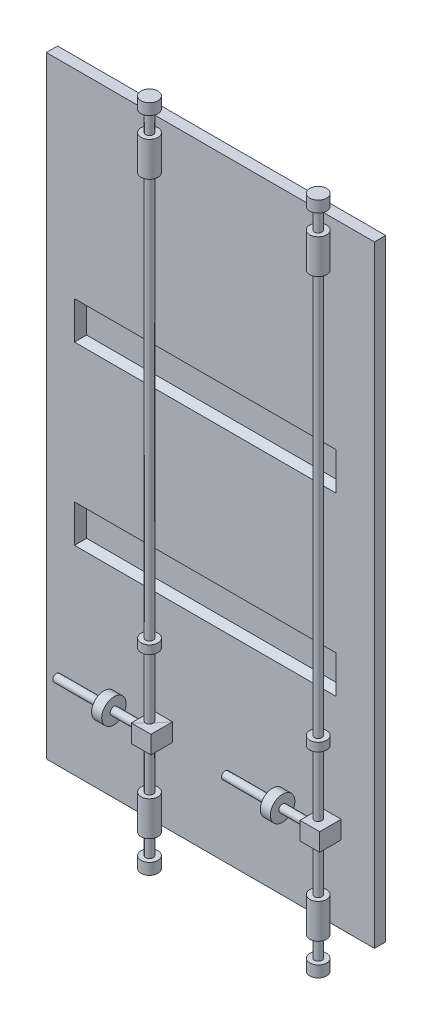
from build123d import *

# Parameters (mm, degrees)
SKETCH1_W                    = 1167
SKETCH1_H                    = 2176
BOSS_EXTRUDE1_DEPTH          = 40
SKETCH2_W                    = 931
SKETCH2_H                    = 134
CUT_EXTRUDE1_DEPTH           = 27
CUT_EXTRUDE1_DRAFT           = -31
CUT_EXTRUDE1_PROFILE_2_DEPTH = 27
CUT_EXTRUDE1_PROFILE_2_DRAFT = -31
CUT_EXTRUDE2_START           = -90
CUT_EXTRUDE2_DEPTH           = 917
BOSS_EXTRUDE2_START          = 110
SKETCH4_R                    = 13.5
BOSS_EXTRUDE2_DEPTH          = 2380
SKETCH5_R                    = 30
BOSS_EXTRUDE3_DEPTH          = 40
BOSS_EXTRUDE4_START          = -113
SKETCH6_R                    = 30
BOSS_EXTRUDE4_DEPTH          = 123
BOSS_EXTRUDE5_START          = -40
SKETCH8_W                    = 76.691760354
SKETCH8_H                    = 63.527166665
BOSS_EXTRUDE5_DEPTH          = 70
SKETCH9_R                    = 13.5
BOSS_EXTRUDE6_DEPTH          = 344
BOSS_EXTRUDE7_START          = -140
SKETCH10_R                   = 43.5
BOSS_EXTRUDE7_DEPTH          = 36
BOSS_EXTRUDE8_START          = -1670
SKETCH11_R                   = 30
BOSS_EXTRUDE8_DEPTH          = 30
LPATTERN2_COUNT              = 2
LPATTERN2_PITCH              = 600
LPATTERN3_START              = -805.424590627
LPATTERN3_OUTLINE_R          = 30
LPATTERN3_DEPTH              = 30
LPATTERN3_START_2            = 61.654119823
LPATTERN3_2_OUTLINE_W        = 70
LPATTERN3_2_OUTLINE_H        = 63.527166665
LPATTERN3_2_DEPTH            = 76.691760354
LPATTERN3_START_3            = 658.575409373
LPATTERN3_3_OUTLINE_R        = 30
LPATTERN3_3_DEPTH            = 123
LPATTERN3_START_4            = 854.575409373
LPATTERN3_4_OUTLINE_R        = 30
LPATTERN3_4_DEPTH            = 40
LPATTERN3_START_5            = 607.040200233
LPATTERN3_5_OUTLINE_W        = 63.527166665
LPATTERN3_5_OUTLINE_H        = 76.691760354
LPATTERN3_5_DEPTH            = 70
LPATTERN3_START_6            = 471.040200233
LPATTERN3_6_OUTLINE_R        = 43.5
LPATTERN3_6_DEPTH            = 36
LPATTERN3_START_7            = 303.040200233
LPATTERN3_7_OUTLINE_R        = 13.5
LPATTERN3_7_DEPTH            = 304
SKETCH12_R                   = 30
BOSS_EXTRUDE9_DEPTH          = 40
BOSS_EXTRUDE10_START         = -113
SKETCH13_R                   = 30
BOSS_EXTRUDE10_DEPTH         = 123


# Read off the part's stored shape, not the designer's step: LPattern3
with BuildPart() as part:
    # Sketch1 → Boss-Extrude1 (new body)
    with BuildSketch(Plane.XY):
        with Locations((790.040200233, -303.424590627)):
            Rectangle(SKETCH1_W, SKETCH1_H)
    extrude(amount=BOSS_EXTRUDE1_DEPTH)


with BuildPart() as cut_extrude1_tool:
    # Sketch2 → Cut-Extrude1 (with draft: the straight prism first)
    with BuildSketch(Plane.XY.offset(40)):
        with Locations((772.040200233, 9.575409373)):
            Rectangle(SKETCH2_W, SKETCH2_H)
    extrude(amount=-CUT_EXTRUDE1_DEPTH)
    # Cut-Extrude1: the draft: its side faces are tilted about the plane it starts from
    cut_extrude1_sides = [cut_extrude1_tool.faces().sort_by_distance(p)[0] for p in [
        (306.540200233, 9.575409373, 26.5),
        (772.040200233, -57.424590627, 26.5),
        (1237.540200233, 9.575409373, 26.5),
        (772.040200233, 76.575409373, 26.5),
    ]]
    draft(cut_extrude1_sides, Plane.XY.offset(40), CUT_EXTRUDE1_DRAFT)


with BuildPart() as part_1:
    add(part.part)

    # Cut-Extrude1: cut by cut_extrude1_tool
    add(cut_extrude1_tool.part, mode=Mode.SUBTRACT)


with BuildPart() as cut_extrude1_profile_2_tool:
    # Sketch2 → Cut-Extrude1 profile 2 (with draft: the straight prism first)
    with BuildSketch(Plane.XY.offset(40)):
        with Locations((772.040200233, -616.424590627)):
            Rectangle(SKETCH2_W, SKETCH2_H)
    extrude(amount=-CUT_EXTRUDE1_PROFILE_2_DEPTH)
    # Cut-Extrude1 profile 2: the draft: its side faces are tilted about the plane it starts from
    cut_extrude1_profile_2_sides = [cut_extrude1_profile_2_tool.faces().sort_by_distance(p)[0] for p in [
        (306.540200233, -616.424590627, 26.5),
        (772.040200233, -683.424590627, 26.5),
        (1237.540200233, -616.424590627, 26.5),
        (772.040200233, -549.424590627, 26.5),
    ]]
    draft(cut_extrude1_profile_2_sides, Plane.XY.offset(40), CUT_EXTRUDE1_PROFILE_2_DRAFT)


with BuildPart() as part_2:
    add(part_1.part)

    # Cut-Extrude1 profile 2: cut by cut_extrude1_profile_2_tool
    add(cut_extrude1_profile_2_tool.part, mode=Mode.SUBTRACT)

    # Sketch3 → Cut-Extrude2 (cut)
    with BuildSketch(Plane(origin=(1373.540200233, 0, 0), x_dir=(0, 0, -1), z_dir=(1, 0, 0)).offset(CUT_EXTRUDE2_START)):
        Polygon((-30, 634.575409373), (-30, 71.566803182), (-3, 55.343566469), (-3, -36.156433531), (-30, -52.379670245), (-30, -340.424590627), (0, -340.424590627), (0, 634.575409373), align=None)
    cut_extrude2 = extrude(amount=-CUT_EXTRUDE2_DEPTH, mode=Mode.SUBTRACT)

    # Mirror1: Cut-Extrude2 across plane
    add(cut_extrude2.mirror(Plane.ZX.offset(-303.424590627)), mode=Mode.SUBTRACT)


with BuildPart() as body_2:
    # Sketch4 → Boss-Extrude2 (new body)
    with BuildSketch(Plane(origin=(0, 784.575409373, 0), x_dir=(1, 0, 0), z_dir=(0, 1, 0)).offset(BOSS_EXTRUDE2_START)):
        with Locations(Location((1233.540200233, -100, 0), (0, 0, 270))):
            Circle(SKETCH4_R)
    boss_extrude2 = extrude(amount=-BOSS_EXTRUDE2_DEPTH)

    # Sketch5 → Boss-Extrude3 (add)
    with BuildSketch(Plane(origin=(0, 894.575409373, 0), x_dir=(1, 0, 0), z_dir=(0, 1, 0))):
        with Locations(Location((1233.540200233, -100, 0), (0, 0, 270))):
            Circle(SKETCH5_R)
    boss_extrude3 = extrude(amount=-BOSS_EXTRUDE3_DEPTH)

    # Sketch6 → Boss-Extrude4 (add)
    with BuildSketch(Plane(origin=(0, 894.575409373, 0), x_dir=(1, 0, 0), z_dir=(0, 1, 0)).offset(BOSS_EXTRUDE4_START)):
        with Locations(Location((1233.540200233, -100, 0), (0, 0, 270))):
            Circle(SKETCH6_R)
    boss_extrude4 = extrude(amount=-BOSS_EXTRUDE4_DEPTH)

    # Mirror2: Boss-Extrude3, Boss-Extrude4 across plane
    add(boss_extrude3.mirror(Plane.ZX.offset(-303.424590627)))
    add(boss_extrude4.mirror(Plane.ZX.offset(-303.424590627)))


with BuildPart() as body_3:
    # Sketch8 → Boss-Extrude5 (new body)
    with BuildSketch(Plane(origin=(1247.040200233, 0, 0), x_dir=(0, 0, -1), z_dir=(1, 0, 0)).offset(BOSS_EXTRUDE5_START)):
        with Locations((-100, -1062.824787132)):
            Rectangle(SKETCH8_W, SKETCH8_H)
    extrude(amount=BOSS_EXTRUDE5_DEPTH)

    # Sketch9 → Boss-Extrude6 (add)
    with BuildSketch(Plane(origin=(1247.040200233, 0, 0), x_dir=(0, 0, -1), z_dir=(1, 0, 0))):
        with Locations((-100, -1062.824787132)):
            Circle(SKETCH9_R)
    extrude(amount=-BOSS_EXTRUDE6_DEPTH)

    # Sketch10 → Boss-Extrude7 (add)
    with BuildSketch(Plane(origin=(1247.040200233, 0, 0), x_dir=(0, 0, -1), z_dir=(1, 0, 0)).offset(BOSS_EXTRUDE7_START)):
        with Locations((-100, -1062.824787132)):
            Circle(SKETCH10_R)
    extrude(amount=-BOSS_EXTRUDE7_DEPTH)


with BuildPart() as body_4:
    # Sketch11 → Boss-Extrude8 (new body)
    with BuildSketch(Plane(origin=(0, 894.575409373, 0), x_dir=(1, 0, 0), z_dir=(0, 1, 0)).offset(BOSS_EXTRUDE8_START)):
        with Locations(Location((1233.540200233, -100, 0), (0, 0, 270))):
            Circle(SKETCH11_R)
    extrude(amount=-BOSS_EXTRUDE8_DEPTH)


with BuildPart() as lpattern2_1:
    # LPattern2: Boss-Extrude2 ×2
    with Locations(*[(-i * LPATTERN2_PITCH, 0, 0) for i in range(1, LPATTERN2_COUNT)]):
        add(boss_extrude2)

    # LPattern3 3 outline → LPattern3 3 (add)
    with BuildSketch(Plane(origin=(0, 0, 0), x_dir=(1, 0, 0), z_dir=(0, 1, 0)).offset(LPATTERN3_START_3)):
        with Locations((633.540200233, -100)):
            Circle(LPATTERN3_3_OUTLINE_R)
    extrude(amount=LPATTERN3_3_DEPTH)

    # LPattern3 4 outline → LPattern3 4 (add)
    with BuildSketch(Plane(origin=(0, 0, 0), x_dir=(1, 0, 0), z_dir=(0, 1, 0)).offset(LPATTERN3_START_4)):
        with Locations((633.540200233, -100)):
            Circle(LPATTERN3_4_OUTLINE_R)
    extrude(amount=LPATTERN3_4_DEPTH)

    # LPattern3 5 outline → LPattern3 5 (add)
    with BuildSketch(Plane.YZ.offset(LPATTERN3_START_5)):
        with Locations((-1062.824787132, 100)):
            Rectangle(LPATTERN3_5_OUTLINE_W, LPATTERN3_5_OUTLINE_H)
    extrude(amount=LPATTERN3_5_DEPTH)

    # LPattern3 6 outline → LPattern3 6 (add)
    with BuildSketch(Plane.YZ.offset(LPATTERN3_START_6)):
        with Locations((-1062.824787132, 100)):
            Circle(LPATTERN3_6_OUTLINE_R)
    extrude(amount=LPATTERN3_6_DEPTH)

    # LPattern3 7 outline → LPattern3 7 (add)
    with BuildSketch(Plane.YZ.offset(LPATTERN3_START_7)):
        with Locations((-1062.824787132, 100)):
            Circle(LPATTERN3_7_OUTLINE_R)
    extrude(amount=LPATTERN3_7_DEPTH)

    # Sketch12 → Boss-Extrude9 (add)
    with BuildSketch(Plane(origin=(0, -1485.424590627, 0), x_dir=(-1, 0, 0), z_dir=(0, -1, 0))):
        with Locations(Location((-633.540200233, -100, 0), (0, 0, 270))):
            Circle(SKETCH12_R)
    extrude(amount=-BOSS_EXTRUDE9_DEPTH)

    # Sketch13 → Boss-Extrude10 (add)
    with BuildSketch(Plane(origin=(0, -1485.424590627, 0), x_dir=(-1, 0, 0), z_dir=(0, -1, 0)).offset(BOSS_EXTRUDE10_START)):
        with Locations(Location((-633.540200233, -100, 0), (0, 0, 270))):
            Circle(SKETCH13_R)
    extrude(amount=-BOSS_EXTRUDE10_DEPTH)


with BuildPart() as body_6:
    # LPattern3 outline → LPattern3 (new body)
    with BuildSketch(Plane(origin=(0, 0, 0), x_dir=(1, 0, 0), z_dir=(0, 1, 0)).offset(LPATTERN3_START)):
        with Locations((633.540200233, -100)):
            Circle(LPATTERN3_OUTLINE_R)
    extrude(amount=LPATTERN3_DEPTH)


with BuildPart() as body_7:
    # LPattern3 2 outline → LPattern3 2 (new body)
    with BuildSketch(Plane.XY.offset(LPATTERN3_START_2)):
        with Locations((642.040200233, -1062.824787132)):
            Rectangle(LPATTERN3_2_OUTLINE_W, LPATTERN3_2_OUTLINE_H)
    extrude(amount=LPATTERN3_2_DEPTH)


solid = Compound([part_2.part, body_2.part, body_3.part, body_4.part, lpattern2_1.part, body_6.part, body_7.part])
